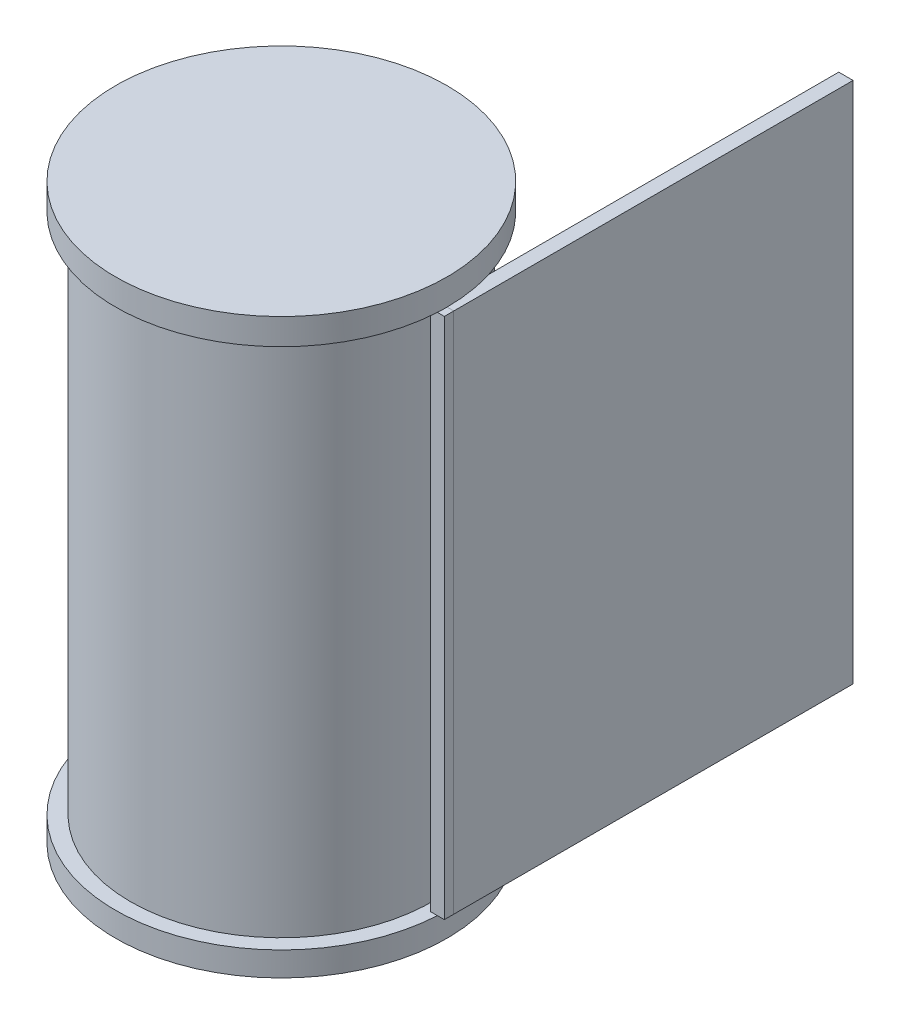
from build123d import *

# Parameters (mm, degrees)
VACIADO1_START                    = -69.409306307
VACIADO1_OUTLINE_R                = 22.113173388
VACIADO1_DEPTH                    = 111.965075994
CROQUIS3_W                        = 3
CROQUIS3_H                        = 111.238505794
SALIENTE_EXTRUIR1_DEPTH           = 85
SALIENTE_EXTRUIR1_TAPER           = -0.018
SALIENTE_EXTRUIR1_OTHER_WAY_DEPTH = 2


# Read off the part's stored shape, not the designer's step: Vaciado1
with BuildPart() as part:
    # Croquis1 → Revolución1 (revolve)
    with BuildSketch(Plane.XY, mode=Mode.PRIVATE) as revoluci_n1_sk:
        Polygon((0, 52.555769687), (0, 46.993844398), (0, -69.409306307), (35.29141641, -69.409306307), (35.29141641, -64.244661396), (32.113173388, -64.244661396), (32.113173388, 46.993844398), (35.29141641, 46.993844398), (35.29141641, 52.555769687), align=None)
    revolve(revoluci_n1_sk.sketch.rotate(Axis((0, -77.4814163, 0), (0, 1, 0)), 90), axis=Axis((0, -77.4814163, 0), (0, 1, 0)))

    # Vaciado1 outline → Vaciado1 (cut)
    with BuildSketch(Plane(origin=(0, 0, 0), x_dir=(1, 0, 0), z_dir=(0, 1, 0)).offset(VACIADO1_START)):
        Circle(VACIADO1_OUTLINE_R)
    extrude(amount=VACIADO1_DEPTH, mode=Mode.SUBTRACT)

    # Croquis3 → Saliente-Extruir1 (add)
    with BuildSketch(Plane(origin=(35.21176327, 0, 0), x_dir=(1, 0, 0), z_dir=(0, 0, 1))):
        with Locations((0, -8.625408499)):
            Rectangle(CROQUIS3_W, CROQUIS3_H)
    extrude(amount=-SALIENTE_EXTRUIR1_DEPTH, taper=SALIENTE_EXTRUIR1_TAPER)

    # Croquis3 → Saliente-Extruir1 other way (add)
    with BuildSketch(Plane(origin=(35.21176327, 0, 0), x_dir=(1, 0, 0), z_dir=(0, 0, 1))):
        with Locations((0, -8.625408499)):
            Rectangle(CROQUIS3_W, CROQUIS3_H)
    extrude(amount=SALIENTE_EXTRUIR1_OTHER_WAY_DEPTH)


solid = part.part
